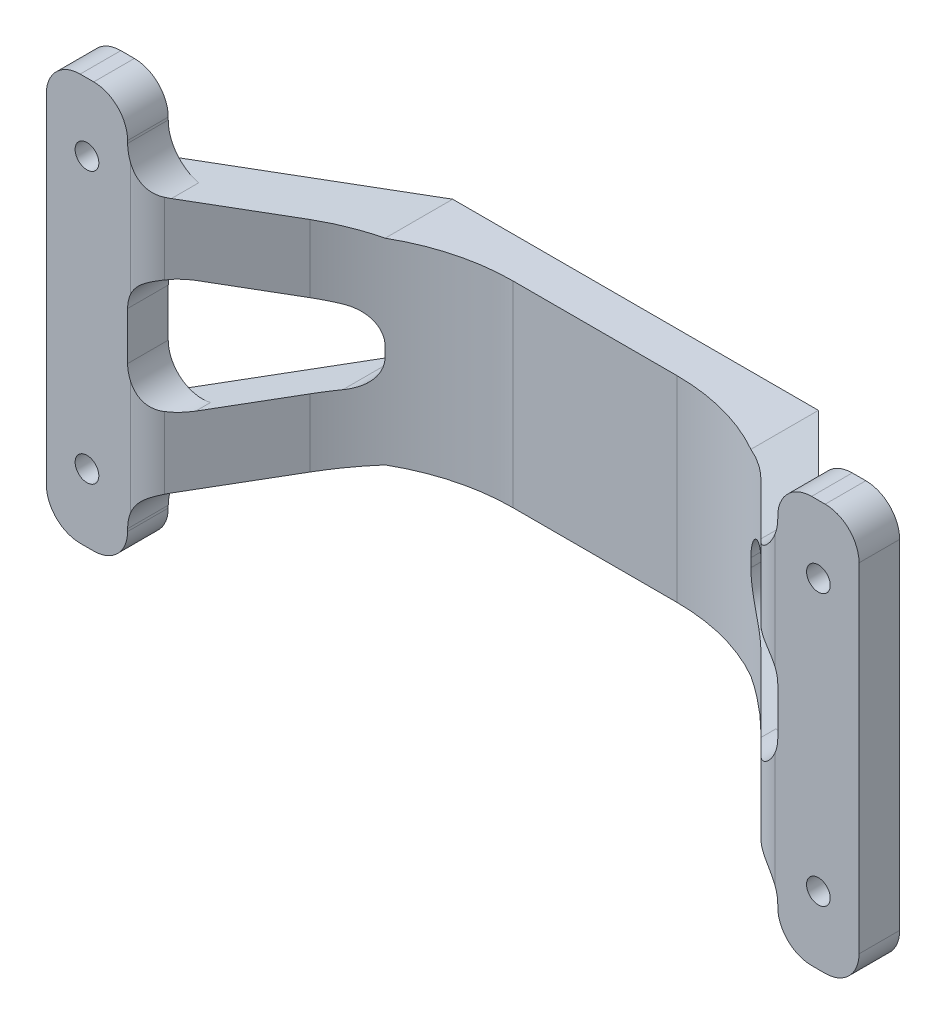
from build123d import *

# Parameters (mm, degrees)
EXTRUDE_1_DEPTH     = 60
SKETCH_2_R          = 1.75
CUT_EXTRUDE_1_DEPTH = 40
SKETCH_3_R          = 4
CUT_EXTRUDE_2_DEPTH = 2
SKETCH_4_R          = 2.5
CUT_EXTRUDE_3_DEPTH = 3
EXTRUDE_START       = 1
SKETCH_5_R          = 5
SKETCH_5_R_2        = 2.5
EXTRUDE_2_DEPTH     = 1
FILLET_1_R          = 5
FILLET_2_R          = 30
FILLET_4_R          = 2
FILLET_5_R          = 5
FILLET_6_R          = 6
FILLET_7_R          = 5


with BuildPart() as part:
    # 草图1 → 凸台-拉伸1 (new body)
    with BuildSketch(Plane(origin=(0, 0, 0), x_dir=(1, 0, 0), z_dir=(0, 1, 0))):
        Polygon((-24.514718626, 0), (24.514718626, 0), (45.514718626, -21), (60, -21), (60, -15), (48, -15), (27, 6), (-27, 6), (-48, -15), (-60, -15), (-60, -21), (-45.514718626, -21), align=None)
    extrude(amount=EXTRUDE_1_DEPTH)

    # 草图2 → 切除-拉伸1 (cut)
    with BuildSketch(Plane(origin=(0, 0, -6), x_dir=(-1, 0, 0), z_dir=(0, 0, -1))):
        with Locations((-54, 50)):
            Circle(SKETCH_2_R)
        with Locations((-54, 10)):
            Circle(SKETCH_2_R)
        with Locations((54, 10)):
            Circle(SKETCH_2_R)
        with Locations((54, 50)):
            Circle(SKETCH_2_R)
        Polygon((-48, 60), (-48, 50), (-27, 44.5), (27, 44.5), (48, 50), (48, 60), align=None)
        Polygon((48, 0), (48, 10), (27, 15.5), (-27, 15.5), (-48, 10), (-48, 0), align=None)
        Polygon((-48, 40), (-27, 34.5), (-27, 25.5), (-48, 20), align=None)
        Polygon((48, 20), (27, 25.5), (27, 34.5), (48, 40), align=None)
    extrude(amount=-CUT_EXTRUDE_1_DEPTH, mode=Mode.SUBTRACT)

    # 草图3 → 切除-拉伸2 (cut)
    with BuildSketch(Plane(origin=(0, 0, 15), x_dir=(-1, 0, 0), z_dir=(0, 0, -1))):
        with Locations((-54, 50)):
            Circle(SKETCH_3_R)
        with Locations(Location((-54, 10, 0), (0, 0, 180))):
            Circle(SKETCH_3_R)
        with Locations((54, 10)):
            Circle(SKETCH_3_R)
        with Locations(Location((54, 50, 0), (0, 0, 180))):
            Circle(SKETCH_3_R)
    extrude(amount=-CUT_EXTRUDE_2_DEPTH, mode=Mode.SUBTRACT)

    # 草图4 → 切除-拉伸3 (cut)
    with BuildSketch(Plane(origin=(0, 0, -6), x_dir=(-1, 0, 0), z_dir=(0, 0, -1))):
        with Locations((0, 30)):
            Circle(SKETCH_4_R)
    extrude(amount=-CUT_EXTRUDE_3_DEPTH, mode=Mode.SUBTRACT)

    # 草图5 → 凸台-拉伸2 (add)
    with BuildSketch(Plane(origin=(0, 0, -6), x_dir=(-1, 0, 0), z_dir=(0, 0, -1)).offset(EXTRUDE_START)):
        with Locations(Location((0, 30, 0), (0, 0, 180))):
            Circle(SKETCH_5_R)
        with Locations((0, 30)):
            Circle(SKETCH_5_R_2, mode=Mode.SUBTRACT)
    extrude(amount=-EXTRUDE_2_DEPTH)

    # 圆角1
    fillet_1_edges = [part.edges().sort_by_distance(p)[0] for p in [
        (60, 60, 18),
        (-60, 0, 18),
        (60, 0, 18),
        (-48, 0, 18),
        (48, 0, 18),
        (-60, 60, 18),
        (48, 60, 18),
        (-48, 60, 18),
    ]]
    fillet(fillet_1_edges, radius=FILLET_1_R)

    # 圆角2
    # the kernel refuses this fillet: 30 mm, written as the material it adds along each edge
    with BuildSketch(Plane(origin=(-24.514718626, -15.566017178, 0), x_dir=(-0.7071067811865465, 0, 0.7071067811865487), z_dir=(0, 1, 0))) as fillet_2_piece_1_section:
        with BuildLine():
            CenterArc((FILLET_2_R * 0.414213562373, FILLET_2_R), FILLET_2_R, 225, 45)
            Line((-FILLET_2_R * 0.292893218813, FILLET_2_R * 0.292893218813), (0, 0))
            Line((0, 0), (FILLET_2_R * 0.414213562373, 0))
        make_face()
    fillet_2_piece_1 = extrude(amount=91.132034356, mode=Mode.PRIVATE)
    fillet_2_piece_1 = split(fillet_2_piece_1, bisect_by=Plane(origin=(-29.494529343, 14.846670886, 5.3692292), z_dir=(-0.25335939183768474, 0.967372223380245, 0)), keep=Keep.TOP, mode=Mode.PRIVATE)
    fillet_2_piece_1 = split(fillet_2_piece_1, bisect_by=Plane(origin=(-31.945457725, 24.204761072, 5.3692292), z_dir=(0.2533593918376857, -0.9673722233802448, 0)), keep=Keep.TOP, mode=Mode.PRIVATE)
    add(fillet_2_piece_1)
    with BuildSketch(Plane(origin=(-24.514718626, 15.5, 0), x_dir=(-0.7071067811865465, 0, 0.7071067811865487), z_dir=(0, 1, 0))) as fillet_2_piece_2_section:
        with BuildLine():
            CenterArc((FILLET_2_R * 0.414213562373, FILLET_2_R), FILLET_2_R, 225, 45)
            Line((-FILLET_2_R * 0.292893218813, FILLET_2_R * 0.292893218813), (0, 0))
            Line((0, 0), (FILLET_2_R * 0.414213562373, 0))
        make_face()
    fillet_2_piece_2 = extrude(amount=29, mode=Mode.PRIVATE)
    fillet_2_piece_2 = split(fillet_2_piece_2, bisect_by=Plane(origin=(-27, 16.298150863, 0.780837191), z_dir=(1, 0, 0)), keep=Keep.TOP, mode=Mode.PRIVATE)
    add(fillet_2_piece_2)
    with BuildSketch(Plane(origin=(-24.514718626, -15.566017178, 0), x_dir=(-0.7071067811865465, 0, 0.7071067811865487), z_dir=(0, 1, 0))) as fillet_2_piece_3_section:
        with BuildLine():
            CenterArc((FILLET_2_R * 0.414213562373, FILLET_2_R), FILLET_2_R, 225, 45)
            Line((-FILLET_2_R * 0.292893218813, FILLET_2_R * 0.292893218813), (0, 0))
            Line((0, 0), (FILLET_2_R * 0.414213562373, 0))
        make_face()
    fillet_2_piece_3 = extrude(amount=91.132034356, mode=Mode.PRIVATE)
    fillet_2_piece_3 = split(fillet_2_piece_3, bisect_by=Plane(origin=(-29.759175244, 35.222641135, 4.528426502), z_dir=(0.25335939183768585, 0.9673722233802448, 0)), keep=Keep.TOP, mode=Mode.PRIVATE)
    fillet_2_piece_3 = split(fillet_2_piece_3, bisect_by=Plane(origin=(-27.308246862, 44.580731321, 4.528426502), z_dir=(-0.2533593918376847, -0.967372223380245, 0)), keep=Keep.TOP, mode=Mode.PRIVATE)
    add(fillet_2_piece_3)
    with BuildSketch(Plane(origin=(24.514718626, -15.566017178, 0), x_dir=(0.7071067811865461, 0, 0.7071067811865488), z_dir=(0, 1, 0))) as fillet_2_piece_4_section:
        with BuildLine():
            CenterArc((FILLET_2_R * 0.414213562373, -FILLET_2_R), FILLET_2_R, 90, 45)
            Line((-FILLET_2_R * 0.292893218813, -FILLET_2_R * 0.292893218813), (0, 0))
            Line((0, 0), (FILLET_2_R * 0.414213562373, 0))
        make_face()
    fillet_2_piece_4 = extrude(amount=91.132034356, mode=Mode.PRIVATE)
    fillet_2_piece_4 = split(fillet_2_piece_4, bisect_by=Plane(origin=(29.494529343, 14.846670886, 5.3692292), z_dir=(0.25335939183768474, 0.967372223380245, 0)), keep=Keep.TOP, mode=Mode.PRIVATE)
    fillet_2_piece_4 = split(fillet_2_piece_4, bisect_by=Plane(origin=(31.945457725, 24.204761072, 5.3692292), z_dir=(-0.25335939183768474, -0.967372223380245, 0)), keep=Keep.TOP, mode=Mode.PRIVATE)
    add(fillet_2_piece_4)
    with BuildSketch(Plane(origin=(24.514718626, 15.5, 0), x_dir=(0.7071067811865461, 0, 0.7071067811865488), z_dir=(0, 1, 0))) as fillet_2_piece_5_section:
        with BuildLine():
            CenterArc((FILLET_2_R * 0.414213562373, -FILLET_2_R), FILLET_2_R, 90, 45)
            Line((-FILLET_2_R * 0.292893218813, -FILLET_2_R * 0.292893218813), (0, 0))
            Line((0, 0), (FILLET_2_R * 0.414213562373, 0))
        make_face()
    fillet_2_piece_5 = extrude(amount=60.066017178, mode=Mode.PRIVATE)
    fillet_2_piece_5 = split(fillet_2_piece_5, bisect_by=Plane(origin=(27, 16.298150863, 0.780837191), z_dir=(-1, 0, 0)), keep=Keep.TOP, mode=Mode.PRIVATE)
    fillet_2_piece_5 = split(fillet_2_piece_5, bisect_by=Plane(origin=(14.384200648, 41.195862074, 0.780837191), z_dir=(0.2533593918376847, -0.967372223380245, 0)), keep=Keep.TOP, mode=Mode.PRIVATE)
    add(fillet_2_piece_5)
    with BuildSketch(Plane(origin=(24.514718626, -15.566017178, 0), x_dir=(0.7071067811865461, 0, 0.7071067811865488), z_dir=(0, 1, 0))) as fillet_2_piece_6_section:
        with BuildLine():
            CenterArc((FILLET_2_R * 0.414213562373, -FILLET_2_R), FILLET_2_R, 90, 45)
            Line((-FILLET_2_R * 0.292893218813, -FILLET_2_R * 0.292893218813), (0, 0))
            Line((0, 0), (FILLET_2_R * 0.414213562373, 0))
        make_face()
    fillet_2_piece_6 = extrude(amount=91.132034356, mode=Mode.PRIVATE)
    fillet_2_piece_6 = split(fillet_2_piece_6, bisect_by=Plane(origin=(29.759175244, 35.222641135, 4.528426502), z_dir=(-0.2533593918376849, 0.967372223380245, 0)), keep=Keep.TOP, mode=Mode.PRIVATE)
    fillet_2_piece_6 = split(fillet_2_piece_6, bisect_by=Plane(origin=(27.308246862, 44.580731321, 4.528426502), z_dir=(0.2533593918376847, -0.967372223380245, 0)), keep=Keep.TOP, mode=Mode.PRIVATE)
    add(fillet_2_piece_6)
    with BuildSketch(Plane(origin=(24.514718626, -15.566017178, 0), x_dir=(0.7071067811865461, 0, 0.7071067811865488), z_dir=(0, 1, 0))) as fillet_2_piece_7_section:
        with BuildLine():
            CenterArc((FILLET_2_R * 0.414213562373, -FILLET_2_R), FILLET_2_R, 90, 45)
            Line((-FILLET_2_R * 0.292893218813, -FILLET_2_R * 0.292893218813), (0, 0))
            Line((0, 0), (FILLET_2_R * 0.414213562373, 0))
        make_face()
    fillet_2_piece_7 = extrude(amount=60.066017178, mode=Mode.PRIVATE)
    fillet_2_piece_7 = split(fillet_2_piece_7, bisect_by=Plane(origin=(21.100650835, 42.954932361, 0.780837191), z_dir=(-0.2533593918376847, 0.967372223380245, 0)), keep=Keep.TOP, mode=Mode.PRIVATE)
    add(fillet_2_piece_7)

    # 圆角4
    fillet_4_edges = [part.edges().sort_by_distance(p)[0] for p in [
        (-48, 45, 15),
        (-48, 15, 15),
        (48, 45, 15),
        (48, 15, 15),
    ]]
    fillet(fillet_4_edges, radius=FILLET_4_R)

    # 圆角5
    fillet_5_edges = [part.edges().sort_by_distance(p)[0] for p in [
        (-45.514718626, 44.349092973, 21),
        (-45.514718626, 15.650907027, 21),
        (45.514718626, 44.349092973, 21),
        (45.514718626, 15.650907027, 21),
    ]]
    fillet(fillet_5_edges, radius=FILLET_5_R)

    # 圆角6
    fillet_6_edges = [part.edges().sort_by_distance(p)[0] for p in [
        (48, 50, 18),
        (-48, 50, 18),
        (-48, 10, 18),
        (48, 10, 18),
    ]]
    fillet(fillet_6_edges, radius=FILLET_6_R)

    # 圆角7
    fillet_7_edges = [part.edges().sort_by_distance(p)[0] for p in [
        (-48, 20, 18),
        (-48, 40, 18),
        (48, 40, 18),
        (48, 20, 18),
        (27, 25.5, -1.015774599),
        (27, 34.5, -1.015774599),
        (-27, 25.5, -1.015774599),
        (-27, 34.5, -1.015774599),
    ]]
    fillet(fillet_7_edges, radius=FILLET_7_R)


solid = part.part
